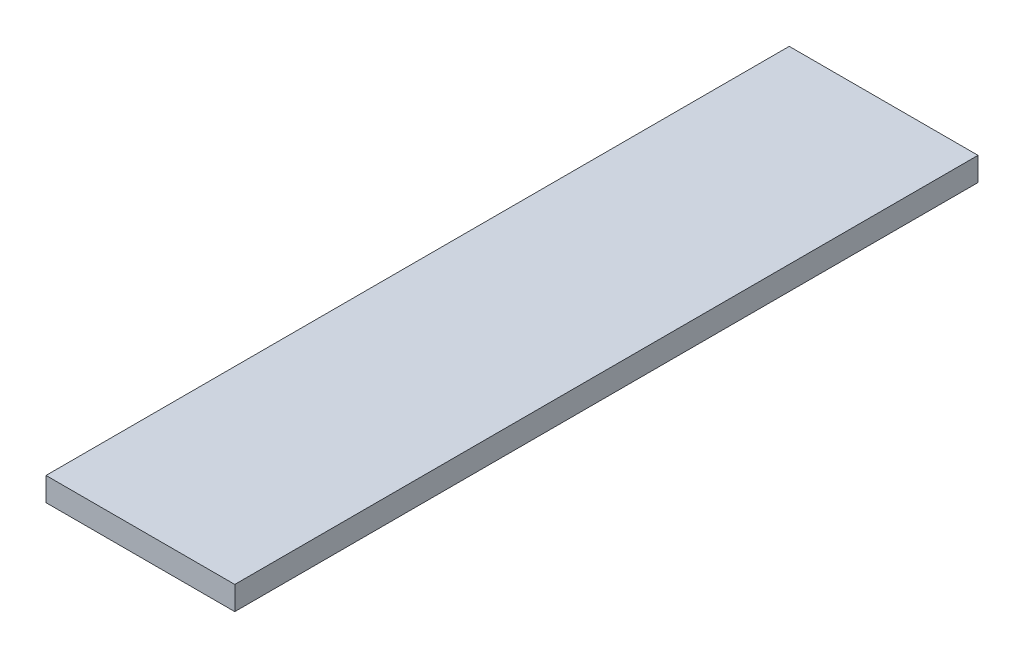
from build123d import *

# Parameters (mm, degrees)
SKETCH1_W           = 25.4
SKETCH1_H           = 100
BOSS_EXTRUDE1_DEPTH = 3.175


with BuildPart() as part:
    # Sketch1 → Boss-Extrude1 (new body)
    with BuildSketch(Plane(origin=(0, 0, 0), x_dir=(1, 0, 0), z_dir=(0, 1, 0))):
        with Locations((12.7, 50)):
            Rectangle(SKETCH1_W, SKETCH1_H)
    extrude(amount=BOSS_EXTRUDE1_DEPTH)


solid = part.part
